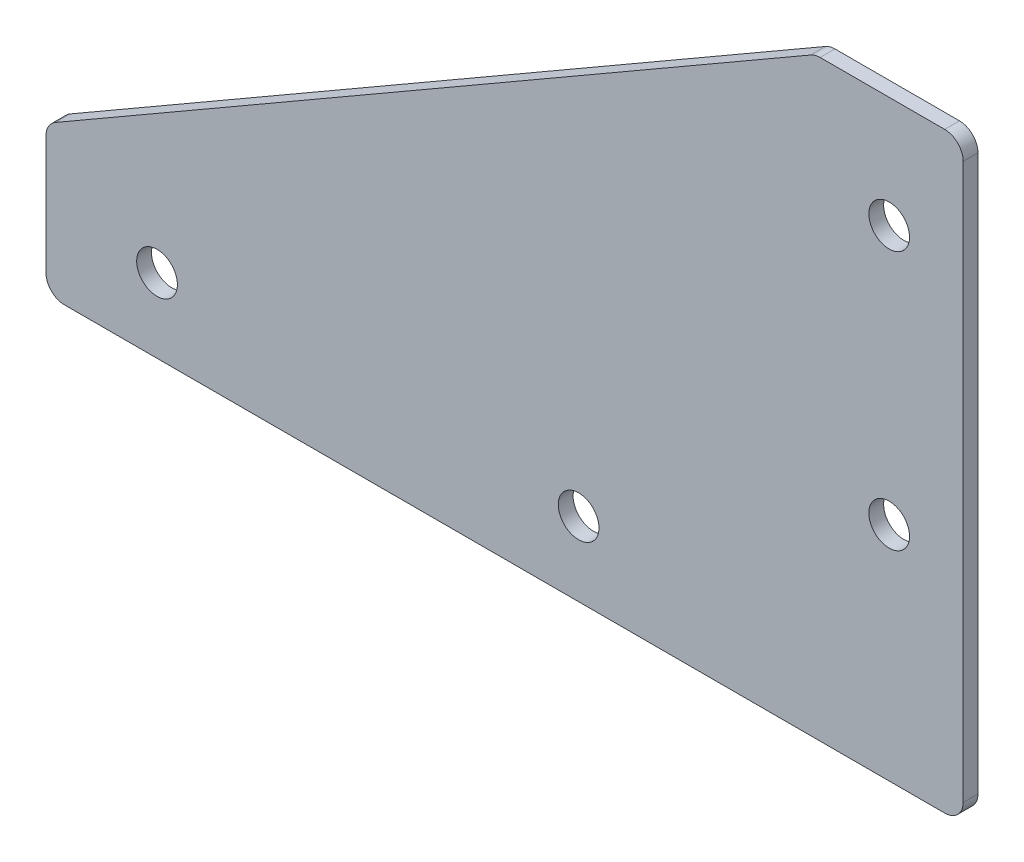
from build123d import *

# Parameters (mm, degrees)
BASE_FLANGE1_DEPTH   = 2
M5_CLEARANCE_HOLE2_D = 5.5
BREAK_CORNER1_START  = -2
BREAK_CORNER1_DEPTH  = 2


# Read off the part's stored shape, not the designer's step: Break-Corner1
# Sheet-metal steps are written as plain solids
with BuildPart() as part:
    # Sketch2 → Base-Flange1 (new body)
    with BuildSketch(Plane.XY):
        Polygon((0, 60), (-103.923048454, 0), (-103.923048454, -20), (20, -20), (20, 0), (20, 60), align=None)
    extrude(amount=-BASE_FLANGE1_DEPTH)

    # M5 Clearance Hole2 (through all)
    with Locations(Plane.XY):
        with Locations((-88.923048454, -10), (-31.96, -10), (10, 10), (10, 45)):
            Hole(M5_CLEARANCE_HOLE2_D / 2)

    # Break-Corner1 outline → Break-Corner1 (cut)
    with BuildSketch(Plane.XY.offset(BREAK_CORNER1_START)):
        with BuildLine():
            ThreePointArc((17.5, 60), (19.267766953, 59.267766953), (20, 57.5))
            Line((20, 57.5), (20, 60))
            Line((20, 60), (17.5, 60))
        make_face()
        with BuildLine():
            Line((20, -20), (20, -17.5))
            ThreePointArc((20, -17.5), (19.267766953, -19.267766953), (17.5, -20))
            Line((17.5, -20), (20, -20))
        make_face()
        with BuildLine():
            ThreePointArc((-0.580127019, 59.665063509), (0.022825368, 59.914814566), (0.669872981, 60))
            Line((0.669872981, 60), (0, 60))
            Line((0, 60), (-0.580127019, 59.665063509))
        make_face()
        with BuildLine():
            Line((-103.923048454, -20), (-101.423048454, -20))
            ThreePointArc((-101.423048454, -20), (-103.190815407, -19.267766953), (-103.923048454, -17.5))
            Line((-103.923048454, -17.5), (-103.923048454, -20))
        make_face()
        with BuildLine():
            ThreePointArc((-103.923048454, -1.443375673), (-103.588111964, -0.193375673), (-102.673048454, 0.721687836))
            Line((-102.673048454, 0.721687836), (-103.923048454, 0))
            Line((-103.923048454, 0), (-103.923048454, -1.443375673))
        make_face()
    extrude(amount=BREAK_CORNER1_DEPTH, mode=Mode.SUBTRACT)


solid = part.part
